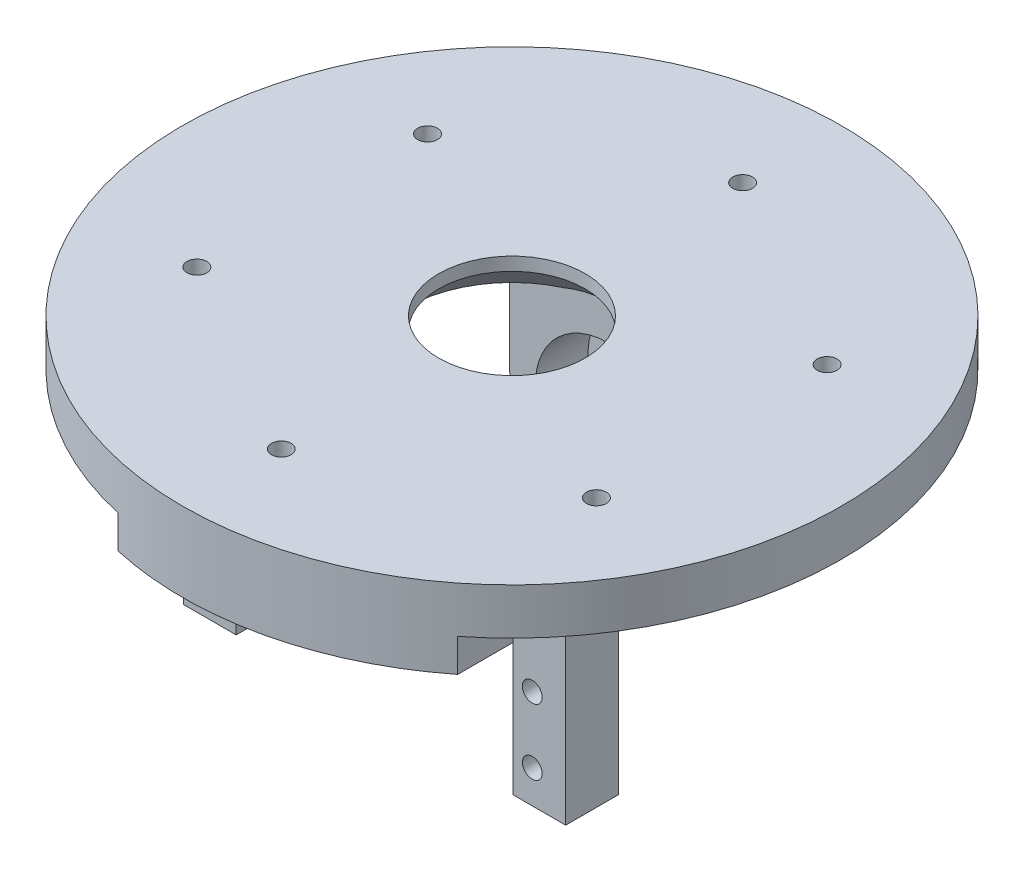
from build123d import *
from build123d.topology import SkipClean

# Parameters (mm, degrees)
SKETCH1_R           = 11.11
BOSS_EXTRUDE1_DEPTH = 8
SKETCH2_R           = 50
SKETCH2_R_2         = 11.11
SKETCH2_R_3         = 1.5
BOSS_EXTRUDE2_DEPTH = 7
SKETCH3_R           = 4
CUT_EXTRUDE1_DEPTH  = 3
SKETCH1_3_R         = 11.11
CUT_EXTRUDE2_DEPTH  = 8
BOSS_EXTRUDE4_DEPTH = 5
SKETCH5_4_W         = 8
SKETCH5_4_H         = 8
BOSS_EXTRUDE5_DEPTH = 25
SKETCH5_5_W         = 8
SKETCH5_5_H         = 8
BOSS_EXTRUDE6_DEPTH = 7
SKETCH8_R           = 1.6
SKETCH8_R_2         = 1.5
CUT_EXTRUDE3_DEPTH  = 35
BOSS_EXTRUDE7_DEPTH = 30
CHAMFER3_SIZE       = 5
SKETCH9_R           = 11.11
SKETCH9_R_2         = 4.25
CUT_EXTRUDE4_DEPTH  = 8
SKETCH9_2_R         = 4.25
CUT_EXTRUDE5_DEPTH  = 85.637834707
SKETCH11_R          = 11
CUT_EXTRUDE6_DEPTH  = 8
CUT_EXTRUDE9_DEPTH  = 85.637834733


# Read off the part's stored shape, not the designer's step: Boss-Extrude4, Boss-Extrude7
with BuildPart() as part:
    # Sketch1 → Boss-Extrude1 (new body)
    with BuildSketch(Plane(origin=(0, 0, 0), x_dir=(1, 0, 0), z_dir=(0, 1, 0))):
        with BuildLine():
            Line((-0.88, 15.975781671), (-0.5, 17.975781671))
            Line((-0.5, 17.975781671), (0.5, 17.975781671))
            Line((0.5, 17.975781671), (0.88, 15.975781671))
            ThreePointArc((0.88, 15.975781671), (1.394491884, 15.939115169), (1.907534551, 15.885884046))
            Line((1.907534551, 15.885884046), (2.629057853, 17.789513245))
            Line((2.629057853, 17.789513245), (3.613865606, 17.615865067))
            Line((3.613865606, 17.615865067), (3.640796197, 15.580263254))
            ThreePointArc((3.640796197, 15.580263254), (4.141104722, 15.454813221), (4.637109631, 15.313301874))
            Line((4.637109631, 15.313301874), (5.678233113, 17.062719461))
            Line((5.678233113, 17.062719461), (6.617925734, 16.720699317))
            Line((6.617925734, 16.720699317), (6.290968643, 14.711346421))
            ThreePointArc((6.290968643, 14.711346421), (6.761892188, 14.500924593), (7.22578848, 14.275432772))
            Line((7.22578848, 14.275432772), (8.554878134, 15.81748358))
            Line((8.554878134, 15.81748358), (9.420903537, 15.31748358))
            Line((9.420903537, 15.31748358), (8.749993191, 13.395432772))
            ThreePointArc((8.749993191, 13.395432772), (9.177222982, 13.106432709), (9.594915403, 12.80381187))
            Line((9.594915403, 12.80381187), (11.171587511, 14.091641465))
            Line((11.171587511, 14.091641465), (11.937631954, 13.448853855))
            Line((11.937631954, 13.448853855), (10.943153623, 11.672505677))
            ThreePointArc((10.943153623, 11.672505677), (11.313708499, 11.313708499), (11.672505677, 10.943153623))
            Line((11.672505677, 10.943153623), (13.448853855, 11.937631954))
            Line((13.448853855, 11.937631954), (14.091641465, 11.171587511))
            Line((14.091641465, 11.171587511), (12.80381187, 9.594915403))
            ThreePointArc((12.80381187, 9.594915403), (13.106432709, 9.177222982), (13.395432772, 8.749993191))
            Line((13.395432772, 8.749993191), (15.31748358, 9.420903537))
            Line((15.31748358, 9.420903537), (15.81748358, 8.554878134))
            Line((15.81748358, 8.554878134), (14.275432772, 7.22578848))
            ThreePointArc((14.275432772, 7.22578848), (14.500924593, 6.761892188), (14.711346421, 6.290968643))
            Line((14.711346421, 6.290968643), (16.720699317, 6.617925734))
            Line((16.720699317, 6.617925734), (17.062719461, 5.678233113))
            Line((17.062719461, 5.678233113), (15.313301874, 4.637109631))
            ThreePointArc((15.313301874, 4.637109631), (15.454813221, 4.141104722), (15.580263254, 3.640796197))
            Line((15.580263254, 3.640796197), (17.615865067, 3.613865606))
            Line((17.615865067, 3.613865606), (17.789513245, 2.629057853))
            Line((17.789513245, 2.629057853), (15.885884046, 1.907534551))
            ThreePointArc((15.885884046, 1.907534551), (15.939115169, 1.394491884), (15.975781671, 0.88))
            Line((15.975781671, 0.88), (17.975781671, 0.5))
            Line((17.975781671, 0.5), (17.975781671, -0.5))
            Line((17.975781671, -0.5), (15.975781671, -0.88))
            ThreePointArc((15.975781671, -0.88), (15.939115169, -1.394491884), (15.885884046, -1.907534551))
            Line((15.885884046, -1.907534551), (17.789513245, -2.629057853))
            Line((17.789513245, -2.629057853), (17.615865067, -3.613865606))
            Line((17.615865067, -3.613865606), (15.580263254, -3.640796197))
            ThreePointArc((15.580263254, -3.640796197), (15.454813221, -4.141104722), (15.313301874, -4.637109631))
            Line((15.313301874, -4.637109631), (17.062719461, -5.678233113))
            Line((17.062719461, -5.678233113), (16.720699317, -6.617925734))
            Line((16.720699317, -6.617925734), (14.711346421, -6.290968643))
            ThreePointArc((14.711346421, -6.290968643), (14.500924593, -6.761892188), (14.275432772, -7.22578848))
            Line((14.275432772, -7.22578848), (15.81748358, -8.554878134))
            Line((15.81748358, -8.554878134), (15.31748358, -9.420903537))
            Line((15.31748358, -9.420903537), (13.395432772, -8.749993191))
            ThreePointArc((13.395432772, -8.749993191), (13.106432709, -9.177222982), (12.80381187, -9.594915403))
            Line((12.80381187, -9.594915403), (14.091641465, -11.171587511))
            Line((14.091641465, -11.171587511), (13.448853855, -11.937631954))
            Line((13.448853855, -11.937631954), (11.672505677, -10.943153623))
            ThreePointArc((11.672505677, -10.943153623), (11.313708499, -11.313708499), (10.943153623, -11.672505677))
            Line((10.943153623, -11.672505677), (11.937631954, -13.448853855))
            Line((11.937631954, -13.448853855), (11.171587511, -14.091641465))
            Line((11.171587511, -14.091641465), (9.594915403, -12.80381187))
            ThreePointArc((9.594915403, -12.80381187), (9.177222982, -13.106432709), (8.749993191, -13.395432772))
            Line((8.749993191, -13.395432772), (9.420903537, -15.31748358))
            Line((9.420903537, -15.31748358), (8.554878134, -15.81748358))
            Line((8.554878134, -15.81748358), (7.22578848, -14.275432772))
            ThreePointArc((7.22578848, -14.275432772), (6.761892188, -14.500924593), (6.290968643, -14.711346421))
            Line((6.290968643, -14.711346421), (6.617925734, -16.720699317))
            Line((6.617925734, -16.720699317), (5.678233113, -17.062719461))
            Line((5.678233113, -17.062719461), (4.637109631, -15.313301874))
            ThreePointArc((4.637109631, -15.313301874), (4.141104722, -15.454813221), (3.640796197, -15.580263254))
            Line((3.640796197, -15.580263254), (3.613865606, -17.615865067))
            Line((3.613865606, -17.615865067), (2.629057853, -17.789513245))
            Line((2.629057853, -17.789513245), (1.907534551, -15.885884046))
            ThreePointArc((1.907534551, -15.885884046), (1.394491884, -15.939115169), (0.88, -15.975781671))
            Line((0.88, -15.975781671), (0.5, -17.975781671))
            Line((0.5, -17.975781671), (-0.5, -17.975781671))
            Line((-0.5, -17.975781671), (-0.88, -15.975781671))
            ThreePointArc((-0.88, -15.975781671), (-1.394491884, -15.939115169), (-1.907534551, -15.885884046))
            Line((-1.907534551, -15.885884046), (-2.629057853, -17.789513245))
            Line((-2.629057853, -17.789513245), (-3.613865606, -17.615865067))
            Line((-3.613865606, -17.615865067), (-3.640796197, -15.580263254))
            ThreePointArc((-3.640796197, -15.580263254), (-4.141104722, -15.454813221), (-4.637109631, -15.313301874))
            Line((-4.637109631, -15.313301874), (-5.678233113, -17.062719461))
            Line((-5.678233113, -17.062719461), (-6.617925734, -16.720699317))
            Line((-6.617925734, -16.720699317), (-6.290968643, -14.711346421))
            ThreePointArc((-6.290968643, -14.711346421), (-6.761892188, -14.500924593), (-7.22578848, -14.275432772))
            Line((-7.22578848, -14.275432772), (-8.554878134, -15.81748358))
            Line((-8.554878134, -15.81748358), (-9.420903537, -15.31748358))
            Line((-9.420903537, -15.31748358), (-8.749993191, -13.395432772))
            ThreePointArc((-8.749993191, -13.395432772), (-9.177222982, -13.106432709), (-9.594915403, -12.80381187))
            Line((-9.594915403, -12.80381187), (-11.171587511, -14.091641465))
            Line((-11.171587511, -14.091641465), (-11.937631954, -13.448853855))
            Line((-11.937631954, -13.448853855), (-10.943153623, -11.672505677))
            ThreePointArc((-10.943153623, -11.672505677), (-11.313708499, -11.313708499), (-11.672505677, -10.943153623))
            Line((-11.672505677, -10.943153623), (-13.448853855, -11.937631954))
            Line((-13.448853855, -11.937631954), (-14.091641465, -11.171587511))
            Line((-14.091641465, -11.171587511), (-12.80381187, -9.594915403))
            ThreePointArc((-12.80381187, -9.594915403), (-13.106432709, -9.177222982), (-13.395432772, -8.749993191))
            Line((-13.395432772, -8.749993191), (-15.31748358, -9.420903537))
            Line((-15.31748358, -9.420903537), (-15.81748358, -8.554878134))
            Line((-15.81748358, -8.554878134), (-14.275432772, -7.22578848))
            ThreePointArc((-14.275432772, -7.22578848), (-14.500924593, -6.761892188), (-14.711346421, -6.290968643))
            Line((-14.711346421, -6.290968643), (-16.720699317, -6.617925734))
            Line((-16.720699317, -6.617925734), (-17.062719461, -5.678233113))
            Line((-17.062719461, -5.678233113), (-15.313301874, -4.637109631))
            ThreePointArc((-15.313301874, -4.637109631), (-15.454813221, -4.141104722), (-15.580263254, -3.640796197))
            Line((-15.580263254, -3.640796197), (-17.615865067, -3.613865606))
            Line((-17.615865067, -3.613865606), (-17.789513245, -2.629057853))
            Line((-17.789513245, -2.629057853), (-15.885884046, -1.907534551))
            ThreePointArc((-15.885884046, -1.907534551), (-15.939115169, -1.394491884), (-15.975781671, -0.88))
            Line((-15.975781671, -0.88), (-17.975781671, -0.5))
            Line((-17.975781671, -0.5), (-17.975781671, 0.5))
            Line((-17.975781671, 0.5), (-15.975781671, 0.88))
            ThreePointArc((-15.975781671, 0.88), (-15.939115169, 1.394491884), (-15.885884046, 1.907534551))
            Line((-15.885884046, 1.907534551), (-17.789513245, 2.629057853))
            Line((-17.789513245, 2.629057853), (-17.615865067, 3.613865606))
            Line((-17.615865067, 3.613865606), (-15.580263254, 3.640796197))
            ThreePointArc((-15.580263254, 3.640796197), (-15.454813221, 4.141104722), (-15.313301874, 4.637109631))
            Line((-15.313301874, 4.637109631), (-17.062719461, 5.678233113))
            Line((-17.062719461, 5.678233113), (-16.720699317, 6.617925734))
            Line((-16.720699317, 6.617925734), (-14.711346421, 6.290968643))
            ThreePointArc((-14.711346421, 6.290968643), (-14.500924593, 6.761892188), (-14.275432772, 7.22578848))
            Line((-14.275432772, 7.22578848), (-15.81748358, 8.554878134))
            Line((-15.81748358, 8.554878134), (-15.31748358, 9.420903537))
            Line((-15.31748358, 9.420903537), (-13.395432772, 8.749993191))
            ThreePointArc((-13.395432772, 8.749993191), (-13.106432709, 9.177222982), (-12.80381187, 9.594915403))
            Line((-12.80381187, 9.594915403), (-14.091641465, 11.171587511))
            Line((-14.091641465, 11.171587511), (-13.448853855, 11.937631954))
            Line((-13.448853855, 11.937631954), (-11.672505677, 10.943153623))
            ThreePointArc((-11.672505677, 10.943153623), (-11.313708499, 11.313708499), (-10.943153623, 11.672505677))
            Line((-10.943153623, 11.672505677), (-11.937631954, 13.448853855))
            Line((-11.937631954, 13.448853855), (-11.171587511, 14.091641465))
            Line((-11.171587511, 14.091641465), (-9.594915403, 12.80381187))
            ThreePointArc((-9.594915403, 12.80381187), (-9.177222982, 13.106432709), (-8.749993191, 13.395432772))
            Line((-8.749993191, 13.395432772), (-9.420903537, 15.31748358))
            Line((-9.420903537, 15.31748358), (-8.554878134, 15.81748358))
            Line((-8.554878134, 15.81748358), (-7.22578848, 14.275432772))
            ThreePointArc((-7.22578848, 14.275432772), (-6.761892188, 14.500924593), (-6.290968643, 14.711346421))
            Line((-6.290968643, 14.711346421), (-6.617925734, 16.720699317))
            Line((-6.617925734, 16.720699317), (-5.678233113, 17.062719461))
            Line((-5.678233113, 17.062719461), (-4.637109631, 15.313301874))
            ThreePointArc((-4.637109631, 15.313301874), (-4.141104722, 15.454813221), (-3.640796197, 15.580263254))
            Line((-3.640796197, 15.580263254), (-3.613865606, 17.615865067))
            Line((-3.613865606, 17.615865067), (-2.629057853, 17.789513245))
            Line((-2.629057853, 17.789513245), (-1.907534551, 15.885884046))
            ThreePointArc((-1.907534551, 15.885884046), (-1.394491884, 15.939115169), (-0.88, 15.975781671))
        make_face()
        with Locations(Location((0, 0, 0), (0, 0, 270))):
            Circle(SKETCH1_R, mode=Mode.SUBTRACT)
    extrude(amount=BOSS_EXTRUDE1_DEPTH)

    # Sketch2 → Boss-Extrude2 (add)
    with BuildSketch(Plane(origin=(0, 8, 0), x_dir=(1, 0, 0), z_dir=(0, 1, 0))):
        with Locations(Location((0, 0, 0), (0, 0, 270))):
            Circle(SKETCH2_R)
        with Locations(Location((0, 0, 0), (0, 0, 270))):
            Circle(SKETCH2_R_2, mode=Mode.SUBTRACT)
        with Locations(Location((0, 35, 0), (0, 0, 270))):
            Circle(SKETCH2_R_3, mode=Mode.SUBTRACT)
        with Locations(Location((30.310889132, 17.5, 0), (0, 0, 270))):
            Circle(SKETCH2_R_3, mode=Mode.SUBTRACT)
        with Locations(Location((30.310889132, -17.5, 0), (0, 0, 270))):
            Circle(SKETCH2_R_3, mode=Mode.SUBTRACT)
        with Locations(Location((0, -35, 0), (0, 0, 270))):
            Circle(SKETCH2_R_3, mode=Mode.SUBTRACT)
        with Locations(Location((-30.310889132, -17.5, 0), (0, 0, 270))):
            Circle(SKETCH2_R_3, mode=Mode.SUBTRACT)
        with Locations(Location((-30.310889132, 17.5, 0), (0, 0, 270))):
            Circle(SKETCH2_R_3, mode=Mode.SUBTRACT)
    extrude(amount=BOSS_EXTRUDE2_DEPTH)

    # Sketch3 → Cut-Extrude1 (cut)
    with BuildSketch(Plane(origin=(0, 8, 0), x_dir=(-1, 0, 0), z_dir=(0, -1, 0))):
        with Locations(Location((0, -35, 0), (0, 0, 90))):
            Circle(SKETCH3_R)
        with Locations(Location((-30.310889132, -17.5, 0), (0, 0, 90))):
            Circle(SKETCH3_R)
        with Locations(Location((-30.310889132, 17.5, 0), (0, 0, 90))):
            Circle(SKETCH3_R)
        with Locations(Location((0, 35, 0), (0, 0, 90))):
            Circle(SKETCH3_R)
        with Locations(Location((30.310889132, 17.5, 0), (0, 0, 90))):
            Circle(SKETCH3_R)
        with Locations(Location((30.310889132, -17.5, 0), (0, 0, 90))):
            Circle(SKETCH3_R)
    extrude(amount=-CUT_EXTRUDE1_DEPTH, mode=Mode.SUBTRACT)

    # Sketch1<3> → Cut-Extrude2 (cut)
    with BuildSketch(Plane(origin=(0, 0, 0), x_dir=(1, 0, 0), z_dir=(0, 1, 0))):
        with BuildLine():
            Line((-0.88, 15.975781671), (-0.5, 17.975781671))
            Line((-0.5, 17.975781671), (0.5, 17.975781671))
            Line((0.5, 17.975781671), (0.88, 15.975781671))
            ThreePointArc((0.88, 15.975781671), (1.394491884, 15.939115169), (1.907534551, 15.885884046))
            Line((1.907534551, 15.885884046), (2.629057853, 17.789513245))
            Line((2.629057853, 17.789513245), (3.613865606, 17.615865067))
            Line((3.613865606, 17.615865067), (3.640796197, 15.580263254))
            ThreePointArc((3.640796197, 15.580263254), (4.141104722, 15.454813221), (4.637109631, 15.313301874))
            Line((4.637109631, 15.313301874), (5.678233113, 17.062719461))
            Line((5.678233113, 17.062719461), (6.617925734, 16.720699317))
            Line((6.617925734, 16.720699317), (6.290968643, 14.711346421))
            ThreePointArc((6.290968643, 14.711346421), (6.761892188, 14.500924593), (7.22578848, 14.275432772))
            Line((7.22578848, 14.275432772), (8.554878134, 15.81748358))
            Line((8.554878134, 15.81748358), (9.420903537, 15.31748358))
            Line((9.420903537, 15.31748358), (8.749993191, 13.395432772))
            ThreePointArc((8.749993191, 13.395432772), (9.177222982, 13.106432709), (9.594915403, 12.80381187))
            Line((9.594915403, 12.80381187), (11.171587511, 14.091641465))
            Line((11.171587511, 14.091641465), (11.937631954, 13.448853855))
            Line((11.937631954, 13.448853855), (10.943153623, 11.672505677))
            ThreePointArc((10.943153623, 11.672505677), (11.313708499, 11.313708499), (11.672505677, 10.943153623))
            Line((11.672505677, 10.943153623), (13.448853855, 11.937631954))
            Line((13.448853855, 11.937631954), (14.091641465, 11.171587511))
            Line((14.091641465, 11.171587511), (12.80381187, 9.594915403))
            ThreePointArc((12.80381187, 9.594915403), (13.106432709, 9.177222982), (13.395432772, 8.749993191))
            Line((13.395432772, 8.749993191), (15.31748358, 9.420903537))
            Line((15.31748358, 9.420903537), (15.81748358, 8.554878134))
            Line((15.81748358, 8.554878134), (14.275432772, 7.22578848))
            ThreePointArc((14.275432772, 7.22578848), (14.500924593, 6.761892188), (14.711346421, 6.290968643))
            Line((14.711346421, 6.290968643), (16.720699317, 6.617925734))
            Line((16.720699317, 6.617925734), (17.062719461, 5.678233113))
            Line((17.062719461, 5.678233113), (15.313301874, 4.637109631))
            ThreePointArc((15.313301874, 4.637109631), (15.454813221, 4.141104722), (15.580263254, 3.640796197))
            Line((15.580263254, 3.640796197), (17.615865067, 3.613865606))
            Line((17.615865067, 3.613865606), (17.789513245, 2.629057853))
            Line((17.789513245, 2.629057853), (15.885884046, 1.907534551))
            ThreePointArc((15.885884046, 1.907534551), (15.939115169, 1.394491884), (15.975781671, 0.88))
            Line((15.975781671, 0.88), (17.975781671, 0.5))
            Line((17.975781671, 0.5), (17.975781671, -0.5))
            Line((17.975781671, -0.5), (15.975781671, -0.88))
            ThreePointArc((15.975781671, -0.88), (15.939115169, -1.394491884), (15.885884046, -1.907534551))
            Line((15.885884046, -1.907534551), (17.789513245, -2.629057853))
            Line((17.789513245, -2.629057853), (17.615865067, -3.613865606))
            Line((17.615865067, -3.613865606), (15.580263254, -3.640796197))
            ThreePointArc((15.580263254, -3.640796197), (15.454813221, -4.141104722), (15.313301874, -4.637109631))
            Line((15.313301874, -4.637109631), (17.062719461, -5.678233113))
            Line((17.062719461, -5.678233113), (16.720699317, -6.617925734))
            Line((16.720699317, -6.617925734), (14.711346421, -6.290968643))
            ThreePointArc((14.711346421, -6.290968643), (14.500924593, -6.761892188), (14.275432772, -7.22578848))
            Line((14.275432772, -7.22578848), (15.81748358, -8.554878134))
            Line((15.81748358, -8.554878134), (15.31748358, -9.420903537))
            Line((15.31748358, -9.420903537), (13.395432772, -8.749993191))
            ThreePointArc((13.395432772, -8.749993191), (13.106432709, -9.177222982), (12.80381187, -9.594915403))
            Line((12.80381187, -9.594915403), (14.091641465, -11.171587511))
            Line((14.091641465, -11.171587511), (13.448853855, -11.937631954))
            Line((13.448853855, -11.937631954), (11.672505677, -10.943153623))
            ThreePointArc((11.672505677, -10.943153623), (11.313708499, -11.313708499), (10.943153623, -11.672505677))
            Line((10.943153623, -11.672505677), (11.937631954, -13.448853855))
            Line((11.937631954, -13.448853855), (11.171587511, -14.091641465))
            Line((11.171587511, -14.091641465), (9.594915403, -12.80381187))
            ThreePointArc((9.594915403, -12.80381187), (9.177222982, -13.106432709), (8.749993191, -13.395432772))
            Line((8.749993191, -13.395432772), (9.420903537, -15.31748358))
            Line((9.420903537, -15.31748358), (8.554878134, -15.81748358))
            Line((8.554878134, -15.81748358), (7.22578848, -14.275432772))
            ThreePointArc((7.22578848, -14.275432772), (6.761892188, -14.500924593), (6.290968643, -14.711346421))
            Line((6.290968643, -14.711346421), (6.617925734, -16.720699317))
            Line((6.617925734, -16.720699317), (5.678233113, -17.062719461))
            Line((5.678233113, -17.062719461), (4.637109631, -15.313301874))
            ThreePointArc((4.637109631, -15.313301874), (4.141104722, -15.454813221), (3.640796197, -15.580263254))
            Line((3.640796197, -15.580263254), (3.613865606, -17.615865067))
            Line((3.613865606, -17.615865067), (2.629057853, -17.789513245))
            Line((2.629057853, -17.789513245), (1.907534551, -15.885884046))
            ThreePointArc((1.907534551, -15.885884046), (1.394491884, -15.939115169), (0.88, -15.975781671))
            Line((0.88, -15.975781671), (0.5, -17.975781671))
            Line((0.5, -17.975781671), (-0.5, -17.975781671))
            Line((-0.5, -17.975781671), (-0.88, -15.975781671))
            ThreePointArc((-0.88, -15.975781671), (-1.394491884, -15.939115169), (-1.907534551, -15.885884046))
            Line((-1.907534551, -15.885884046), (-2.629057853, -17.789513245))
            Line((-2.629057853, -17.789513245), (-3.613865606, -17.615865067))
            Line((-3.613865606, -17.615865067), (-3.640796197, -15.580263254))
            ThreePointArc((-3.640796197, -15.580263254), (-4.141104722, -15.454813221), (-4.637109631, -15.313301874))
            Line((-4.637109631, -15.313301874), (-5.678233113, -17.062719461))
            Line((-5.678233113, -17.062719461), (-6.617925734, -16.720699317))
            Line((-6.617925734, -16.720699317), (-6.290968643, -14.711346421))
            ThreePointArc((-6.290968643, -14.711346421), (-6.761892188, -14.500924593), (-7.22578848, -14.275432772))
            Line((-7.22578848, -14.275432772), (-8.554878134, -15.81748358))
            Line((-8.554878134, -15.81748358), (-9.420903537, -15.31748358))
            Line((-9.420903537, -15.31748358), (-8.749993191, -13.395432772))
            ThreePointArc((-8.749993191, -13.395432772), (-9.177222982, -13.106432709), (-9.594915403, -12.80381187))
            Line((-9.594915403, -12.80381187), (-11.171587511, -14.091641465))
            Line((-11.171587511, -14.091641465), (-11.937631954, -13.448853855))
            Line((-11.937631954, -13.448853855), (-10.943153623, -11.672505677))
            ThreePointArc((-10.943153623, -11.672505677), (-11.313708499, -11.313708499), (-11.672505677, -10.943153623))
            Line((-11.672505677, -10.943153623), (-13.448853855, -11.937631954))
            Line((-13.448853855, -11.937631954), (-14.091641465, -11.171587511))
            Line((-14.091641465, -11.171587511), (-12.80381187, -9.594915403))
            ThreePointArc((-12.80381187, -9.594915403), (-13.106432709, -9.177222982), (-13.395432772, -8.749993191))
            Line((-13.395432772, -8.749993191), (-15.31748358, -9.420903537))
            Line((-15.31748358, -9.420903537), (-15.81748358, -8.554878134))
            Line((-15.81748358, -8.554878134), (-14.275432772, -7.22578848))
            ThreePointArc((-14.275432772, -7.22578848), (-14.500924593, -6.761892188), (-14.711346421, -6.290968643))
            Line((-14.711346421, -6.290968643), (-16.720699317, -6.617925734))
            Line((-16.720699317, -6.617925734), (-17.062719461, -5.678233113))
            Line((-17.062719461, -5.678233113), (-15.313301874, -4.637109631))
            ThreePointArc((-15.313301874, -4.637109631), (-15.454813221, -4.141104722), (-15.580263254, -3.640796197))
            Line((-15.580263254, -3.640796197), (-17.615865067, -3.613865606))
            Line((-17.615865067, -3.613865606), (-17.789513245, -2.629057853))
            Line((-17.789513245, -2.629057853), (-15.885884046, -1.907534551))
            ThreePointArc((-15.885884046, -1.907534551), (-15.939115169, -1.394491884), (-15.975781671, -0.88))
            Line((-15.975781671, -0.88), (-17.975781671, -0.5))
            Line((-17.975781671, -0.5), (-17.975781671, 0.5))
            Line((-17.975781671, 0.5), (-15.975781671, 0.88))
            ThreePointArc((-15.975781671, 0.88), (-15.939115169, 1.394491884), (-15.885884046, 1.907534551))
            Line((-15.885884046, 1.907534551), (-17.789513245, 2.629057853))
            Line((-17.789513245, 2.629057853), (-17.615865067, 3.613865606))
            Line((-17.615865067, 3.613865606), (-15.580263254, 3.640796197))
            ThreePointArc((-15.580263254, 3.640796197), (-15.454813221, 4.141104722), (-15.313301874, 4.637109631))
            Line((-15.313301874, 4.637109631), (-17.062719461, 5.678233113))
            Line((-17.062719461, 5.678233113), (-16.720699317, 6.617925734))
            Line((-16.720699317, 6.617925734), (-14.711346421, 6.290968643))
            ThreePointArc((-14.711346421, 6.290968643), (-14.500924593, 6.761892188), (-14.275432772, 7.22578848))
            Line((-14.275432772, 7.22578848), (-15.81748358, 8.554878134))
            Line((-15.81748358, 8.554878134), (-15.31748358, 9.420903537))
            Line((-15.31748358, 9.420903537), (-13.395432772, 8.749993191))
            ThreePointArc((-13.395432772, 8.749993191), (-13.106432709, 9.177222982), (-12.80381187, 9.594915403))
            Line((-12.80381187, 9.594915403), (-14.091641465, 11.171587511))
            Line((-14.091641465, 11.171587511), (-13.448853855, 11.937631954))
            Line((-13.448853855, 11.937631954), (-11.672505677, 10.943153623))
            ThreePointArc((-11.672505677, 10.943153623), (-11.313708499, 11.313708499), (-10.943153623, 11.672505677))
            Line((-10.943153623, 11.672505677), (-11.937631954, 13.448853855))
            Line((-11.937631954, 13.448853855), (-11.171587511, 14.091641465))
            Line((-11.171587511, 14.091641465), (-9.594915403, 12.80381187))
            ThreePointArc((-9.594915403, 12.80381187), (-9.177222982, 13.106432709), (-8.749993191, 13.395432772))
            Line((-8.749993191, 13.395432772), (-9.420903537, 15.31748358))
            Line((-9.420903537, 15.31748358), (-8.554878134, 15.81748358))
            Line((-8.554878134, 15.81748358), (-7.22578848, 14.275432772))
            ThreePointArc((-7.22578848, 14.275432772), (-6.761892188, 14.500924593), (-6.290968643, 14.711346421))
            Line((-6.290968643, 14.711346421), (-6.617925734, 16.720699317))
            Line((-6.617925734, 16.720699317), (-5.678233113, 17.062719461))
            Line((-5.678233113, 17.062719461), (-4.637109631, 15.313301874))
            ThreePointArc((-4.637109631, 15.313301874), (-4.141104722, 15.454813221), (-3.640796197, 15.580263254))
            Line((-3.640796197, 15.580263254), (-3.613865606, 17.615865067))
            Line((-3.613865606, 17.615865067), (-2.629057853, 17.789513245))
            Line((-2.629057853, 17.789513245), (-1.907534551, 15.885884046))
            ThreePointArc((-1.907534551, 15.885884046), (-1.394491884, 15.939115169), (-0.88, 15.975781671))
        make_face()
        with Locations(Location((0, 0, 0), (0, 0, 270))):
            Circle(SKETCH1_3_R, mode=Mode.SUBTRACT)
    extrude(amount=CUT_EXTRUDE2_DEPTH, mode=Mode.SUBTRACT)

    # Boss-Extrude4 outline → Boss-Extrude4 (add)
    with SkipClean():  # the faces are left unmerged after this step: merging them gives an invalid solid
        with BuildSketch(Plane.XZ.offset(-8)):
            with BuildLine():
                ThreePointArc((-6.000083651, 9.350459677), (0, 11.11), (6.000083651, 9.350459677))
                Line((6.000083651, 9.350459677), (31, 9.350459677))
                Line((31, 9.350459677), (31, 13.559806323))
                ThreePointArc((31, 13.559806323), (26.310889132, 17.5), (31, 21.440193677))
                Line((31, 21.440193677), (31, 39.230090492))
                ThreePointArc((31, 39.230090492), (11.080446462, 48.75678113), (-11, 48.774993593))
                Line((-11, 48.774993593), (-11, 9.350459677))
                Line((-11, 9.350459677), (-6.000083651, 9.350459677))
            make_face()
            with BuildLine():
                Line((-5, 15.350459677), (-5, 43.714985989))
                ThreePointArc((-5, 43.714985989), (10.681278396, 42.683841109), (25, 36.20773398))
                Line((25, 36.20773398), (25, 15.350459677))
                Line((25, 15.350459677), (-5, 15.350459677))
            make_face(mode=Mode.SUBTRACT)
        extrude(amount=BOSS_EXTRUDE4_DEPTH)

    # Sketch5<4> → Boss-Extrude5 (add)
    with SkipClean():  # the faces are left unmerged after this step: merging them gives an invalid solid
        with BuildSketch(Plane.XZ.offset(-8)):
            with BuildLine():
                Line((31, 30.850459677), (31, 22.850459677))
                Line((31, 22.850459677), (37.601283123, 22.850459677))
                ThreePointArc((37.601283123, 22.850459677), (34.718210549, 27.030461636), (31.372745141, 30.850459677))
                Line((31.372745141, 30.850459677), (31, 30.850459677))
            make_face()
            with BuildLine():
                ThreePointArc((31.372745141, 30.850459677), (34.718210549, 27.030461636), (37.601283123, 22.850459677))
                Line((37.601283123, 22.850459677), (39, 22.850459677))
                Line((39, 22.850459677), (39, 30.850459677))
                Line((39, 30.850459677), (31.372745141, 30.850459677))
            make_face()
            with Locations((-15, 26.850459677)):
                Rectangle(SKETCH5_4_W, SKETCH5_4_H)
        extrude(amount=BOSS_EXTRUDE5_DEPTH)

    # Sketch5<5> → Boss-Extrude6 (add)
    with SkipClean():  # the faces are left unmerged after this step: merging them gives an invalid solid
        with BuildSketch(Plane.XZ.offset(-8)):
            with Locations((-15, 26.850459677)):
                Rectangle(SKETCH5_5_W, SKETCH5_5_H)
            with BuildLine():
                Line((3.984617675, -34.649540323), (15, -34.649540323))
                Line((15, -34.649540323), (15, -14.649540323))
                Line((15, -14.649540323), (-15, -14.649540323))
                Line((-15, -14.649540323), (-15, -34.649540323))
                Line((-15, -34.649540323), (-3.984617675, -34.649540323))
                ThreePointArc((-3.984617675, -34.649540323), (0, -31), (3.984617675, -34.649540323))
            make_face()
        extrude(amount=-BOSS_EXTRUDE6_DEPTH)

    # Sketch8 → Cut-Extrude3 (cut)
    with SkipClean():  # the faces are left unmerged after this step: merging them gives an invalid solid
        with BuildSketch(Plane(origin=(0, 0, 22.850459677), x_dir=(-1, 0, 0), z_dir=(0, 0, -1))):
            with Locations((14.071152292, -2)):
                Circle(SKETCH8_R)
            with Locations((14.071152292, -12)):
                Circle(SKETCH8_R)
            with Locations((-33.928847708, -2)):
                Circle(SKETCH8_R_2)
            with Locations((-33.928847708, -12)):
                Circle(SKETCH8_R_2)
        extrude(amount=-CUT_EXTRUDE3_DEPTH, mode=Mode.SUBTRACT)

    # Boss-Extrude7 outline → Boss-Extrude7 (add)
    with SkipClean():  # the faces are left unmerged after this step: merging them gives an invalid solid
        with BuildSketch(Plane.XZ.offset(-8)):
            with BuildLine():
                ThreePointArc((-3.984617675, -34.649540323), (0, -31), (3.984617675, -34.649540323))
                Line((3.984617675, -34.649540323), (15, -34.649540323))
                Line((15, -34.649540323), (15, -14.649540323))
                Line((15, -14.649540323), (-15, -14.649540323))
                Line((-15, -14.649540323), (-15, -34.649540323))
                Line((-15, -34.649540323), (-3.984617675, -34.649540323))
            make_face()
        extrude(amount=BOSS_EXTRUDE7_DEPTH)

    # Chamfer3
    # the kernel refuses this chamfer: 5 mm, written as the material it takes off along each edge
    with BuildSketch(Plane(origin=(0, 8, 0), x_dir=(0.003141587485879406, 0, 0.9999950652018582), z_dir=(-0.9999950652018582, 0, 0.003141587485879406))) as chamfer3_piece_1_section:
        Polygon((11.11 + CHAMFER3_SIZE, 0), (11.11, CHAMFER3_SIZE), (11.11, 0), align=None)
    chamfer3_piece_1 = revolve(axis=Axis((0, 8, 0), (0, 1, 0)), revolution_arc=359.64, mode=Mode.PRIVATE)
    chamfer3_piece_1 = split(chamfer3_piece_1, bisect_by=Plane(origin=(7.319628452, 10.442250887, 9.350459677), z_dir=(0, 0, -1)), keep=Keep.TOP, mode=Mode.PRIVATE)
    chamfer3_piece_1 = split(chamfer3_piece_1, bisect_by=Plane(origin=(7.319628452, 10.442250887, -14.649540323), z_dir=(0, 0, 1)), keep=Keep.TOP, mode=Mode.PRIVATE)
    add(chamfer3_piece_1, mode=Mode.SUBTRACT)
    with BuildSketch(Plane(origin=(0, 8, 0), x_dir=(0.003141587485879406, 0, 0.9999950652018582), z_dir=(-0.9999950652018582, 0, 0.003141587485879406))) as chamfer3_piece_2_section:
        Polygon((11.11 + CHAMFER3_SIZE, 0), (11.11, CHAMFER3_SIZE), (11.11, 0), align=None)
    chamfer3_piece_2 = revolve(axis=Axis((0, 8, 0), (0, 1, 0)), revolution_arc=359.64, mode=Mode.PRIVATE)
    chamfer3_piece_2 = split(chamfer3_piece_2, bisect_by=Plane(origin=(-11, 8.420331781, 9.97792902), z_dir=(-1, 0, 0)), keep=Keep.TOP, mode=Mode.PRIVATE)
    add(chamfer3_piece_2, mode=Mode.SUBTRACT)

    # Sketch9 → Cut-Extrude4 (cut)
    with BuildSketch(Plane.XY.offset(-14.649540323)):
        with Locations((0, -7)):
            Circle(SKETCH9_R)
        with Locations((0, -7)):
            Circle(SKETCH9_R_2, mode=Mode.SUBTRACT)
    extrude(amount=-CUT_EXTRUDE4_DEPTH, mode=Mode.SUBTRACT)

    # Sketch9<2> → Cut-Extrude5 (cut, through all)
    with BuildSketch(Plane.XY.offset(-14.649540323)):
        with Locations((0, -7)):
            Circle(SKETCH9_2_R)
    extrude(amount=-CUT_EXTRUDE5_DEPTH, mode=Mode.SUBTRACT)

    # Sketch11 → Cut-Extrude6 (cut)
    with BuildSketch(Plane(origin=(0, 0, -34.649540323), x_dir=(-1, 0, 0), z_dir=(0, 0, -1))):
        with Locations((0, -7)):
            Circle(SKETCH11_R)
    extrude(amount=-CUT_EXTRUDE6_DEPTH, mode=Mode.SUBTRACT)

    # Sketch12 → Cut-Extrude9 (cut, through all)
    with BuildSketch(Plane.XY.offset(-14.649540323)):
        with BuildLine():
            ThreePointArc((0, -22), (-10.606601732, -17.606601704), (-15, -6.99999996))
            Line((-15, -6.99999996), (-15, -22))
            Line((-15, -22), (0, -22))
        make_face()
        with BuildLine():
            Line((15, -22), (15, -7))
            ThreePointArc((15, -7), (10.606601718, -17.606601718), (0, -22))
            Line((0, -22), (15, -22))
        make_face()
    extrude(amount=-CUT_EXTRUDE9_DEPTH, mode=Mode.SUBTRACT)


solid = part.part
